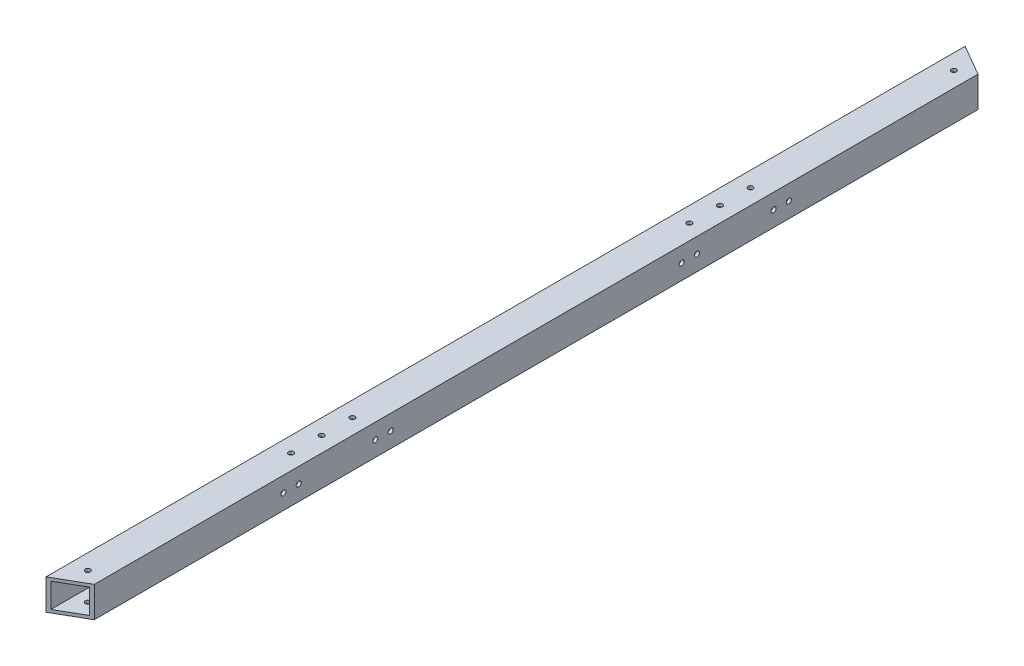
from build123d import *

# Parameters (mm, degrees)
SKETCH_1_W          = 20
SKETCH_1_H          = 20
SKETCH_1_W_2        = 16
SKETCH_1_H_2        = 16
EXTRUDE_1_DEPTH     = 600
CUT_EXTRUDE_1_DEPTH = 300
SKETCH_3_R          = 1.65
CUT_EXTRUDE_2_DEPTH = 300
SKETCH_4_R          = 1.65
CUT_EXTRUDE_3_DEPTH = 10
SKETCH_6_R          = 1.65
CUT_EXTRUDE_4_DEPTH = 601.416522091


with BuildPart() as part:
    # 草图1 → 凸台-拉伸1 (new body)
    with BuildSketch(Plane.XY):
        Rectangle(SKETCH_1_W, SKETCH_1_H)
        Rectangle(SKETCH_1_W_2, SKETCH_1_H_2, mode=Mode.SUBTRACT)
    extrude(amount=EXTRUDE_1_DEPTH)

    # 草图2 → 切除-拉伸1 (cut, symmetric)
    with BuildSketch(Plane(origin=(0, 10, 0), x_dir=(1, 0, 0), z_dir=(0, 1, 0))):
        Polygon((-10, 0), (10, -11.547005384), (10, 0), align=None)
        Polygon((10, -600), (-10, -600), (10, -588.452994616), align=None)
    extrude(amount=CUT_EXTRUDE_1_DEPTH, both=True, mode=Mode.SUBTRACT)

    # 草图3 → 切除-拉伸2 (cut, symmetric)
    with BuildSketch(Plane(origin=(0, 10, 0), x_dir=(1, 0, 0), z_dir=(0, 1, 0))):
        with Locations((0, -17.318286674)):
            Circle(SKETCH_3_R)
        with Locations((0, -582.681713326)):
            Circle(SKETCH_3_R)
    extrude(amount=CUT_EXTRUDE_2_DEPTH, both=True, mode=Mode.SUBTRACT)

    # 草图4 → 切除-拉伸3 (cut, symmetric)
    with BuildSketch(Plane(origin=(0, 0, 0), x_dir=(1, 0, 0), z_dir=(0, 1, 0))):
        with Locations((0, -169.998286674)):
            Circle(SKETCH_4_R)
        with Locations((0, -429.998286674)):
            Circle(SKETCH_4_R)
        with Locations((0, -149.998286674)):
            Circle(SKETCH_4_R)
        with Locations((0, -189.998286674)):
            Circle(SKETCH_4_R)
        with Locations((0, -409.998286674)):
            Circle(SKETCH_4_R)
        with Locations((0, -449.998286674)):
            Circle(SKETCH_4_R)
    extrude(amount=CUT_EXTRUDE_3_DEPTH, both=True, mode=Mode.SUBTRACT)

    # 草图6 → 切除-拉伸4 (cut, through all)
    with BuildSketch(Plane.ZY.offset(10)):
        with Locations((195, 0)):
            Circle(SKETCH_6_R)
        with Locations((145, 0)):
            Circle(SKETCH_6_R)
        with Locations((205, 0)):
            Circle(SKETCH_6_R)
        with Locations((135, 0)):
            Circle(SKETCH_6_R)
        with Locations((465, 0)):
            Circle(SKETCH_6_R)
        with Locations((395, 0)):
            Circle(SKETCH_6_R)
        with Locations((455, 0)):
            Circle(SKETCH_6_R)
        with Locations((405, 0)):
            Circle(SKETCH_6_R)
    extrude(amount=-CUT_EXTRUDE_4_DEPTH, mode=Mode.SUBTRACT)


solid = part.part
